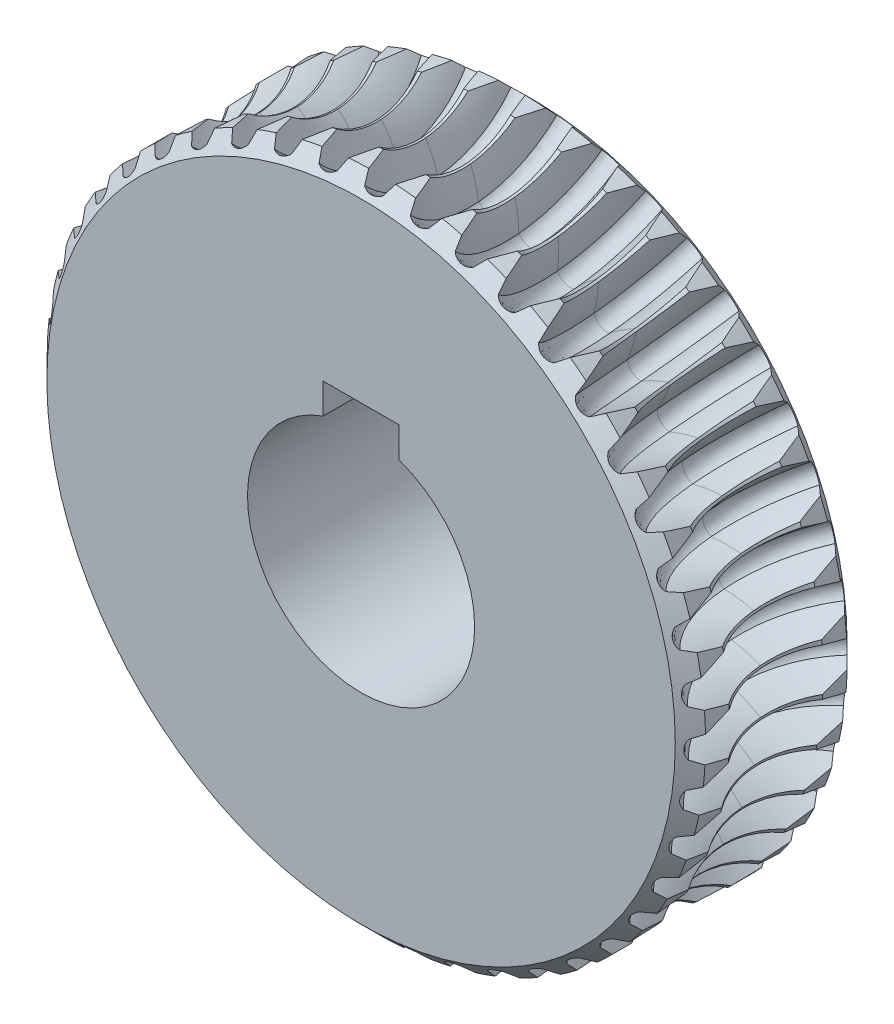
from build123d import *

# Parameters (mm, degrees)
CROQUIS1_R                 = 43.5
SALIENTE_EXTRUIR1_DEPTH    = 11.35
CHAFL_N1_SIZE              = 2
CROQUIS2_R                 = 10.5
CORTAR_BARRER1_PITCH       = 6
CORTAR_BARRER1_HEIGHT      = 1.5
CORTAR_BARRER1_RADIUS      = 10.5
CORTAR_BARRER1_START_ANGLE = -90
CORTAR_BARRER2_PITCH       = 6
CORTAR_BARRER2_HEIGHT      = 1.5
CORTAR_BARRER2_RADIUS      = 10.5
CORTAR_BARRER2_START_ANGLE = -90
MATRIZC1_COUNT             = 44


with BuildPart() as part:
    # Croquis1 → Saliente-Extruir1 (new, symmetric)
    with BuildSketch(Plane.XY):
        Circle(CROQUIS1_R)
        with BuildLine():
            Line((-5, 18.142135624), (5, 18.142135624))
            Line((5, 18.142135624), (5, 14.142135624))
            ThreePointArc((5, 14.142135624), (0, -15), (-5, 14.142135624))
            Line((-5, 14.142135624), (-5, 18.142135624))
        make_face(mode=Mode.SUBTRACT)
    extrude(amount=SALIENTE_EXTRUIR1_DEPTH, both=True)

    # Chaflán1
    chafl_n1_edges = [part.edges().sort_by_distance(p)[0] for p in [
        (-43.5, 0, -11.35),
        (-43.5, 0, 11.35),
    ]]
    chamfer(chafl_n1_edges, length=CHAFL_N1_SIZE)

    # Croquis2 → Cortar-Revolución1 (revolve, cut)
    with BuildSketch(Plane(origin=(0, 0, 0), x_dir=(0, 0, -1), z_dir=(1, 0, 0)), mode=Mode.PRIVATE) as cortar_revoluci_n1_sk:
        with Locations((0, -52)):
            Circle(CROQUIS2_R)
    revolve(cortar_revoluci_n1_sk.sketch.rotate(Axis((0, 0, 0), (0, 0, -1)), 270), axis=Axis((0, 0, 0), (0, 0, -1)), mode=Mode.SUBTRACT)

    # Cortar-Barrer1: sweep along a helix
    with BuildLine() as cortar_barrer1_path:
        add(Helix(CORTAR_BARRER1_PITCH, CORTAR_BARRER1_HEIGHT, CORTAR_BARRER1_RADIUS, center=(0, -52, 0), direction=(-1, 0, 0), lefthand=True, mode=Mode.PRIVATE).rotate(Axis((0, -52, 0), (-1, 0, 0)), CORTAR_BARRER1_START_ANGLE))
    # Croquis4 → Cortar-Barrer1 (sweep, cut)
    with BuildSketch(Plane.XY):
        with BuildLine():
            Line((-3.45, -44.94), (3.45, -44.94))
            Line((3.45, -44.94), (3.45, -42.44))
            ThreePointArc((3.45, -42.44), (2.158263743, -40.196055995), (1.201831935, -37.79))
            ThreePointArc((1.201831935, -37.79), (0, -37.33), (-1.201831935, -37.79))
            ThreePointArc((-1.201831935, -37.79), (-2.158263743, -40.196055995), (-3.45, -42.44))
            Line((-3.45, -42.44), (-3.45, -44.94))
        make_face()
    cortar_barrer1 = sweep(path=cortar_barrer1_path.line, is_frenet=True, mode=Mode.SUBTRACT)

    # Cortar-Barrer2: sweep along a helix
    with BuildLine() as cortar_barrer2_path:
        add(Helix(CORTAR_BARRER2_PITCH, CORTAR_BARRER2_HEIGHT, CORTAR_BARRER2_RADIUS, center=(0, -52, 0), direction=(1, 0, 0), lefthand=True, mode=Mode.PRIVATE).rotate(Axis((0, -52, 0), (1, 0, 0)), CORTAR_BARRER2_START_ANGLE))
    # Croquis4<2> → Cortar-Barrer2 (sweep, cut)
    with BuildSketch(Plane.XY):
        with BuildLine():
            Line((-3.45, -44.94), (3.45, -44.94))
            Line((3.45, -44.94), (3.45, -42.44))
            ThreePointArc((3.45, -42.44), (2.158263743, -40.196055995), (1.201831935, -37.79))
            ThreePointArc((1.201831935, -37.79), (0, -37.33), (-1.201831935, -37.79))
            ThreePointArc((-1.201831935, -37.79), (-2.158263743, -40.196055995), (-3.45, -42.44))
            Line((-3.45, -42.44), (-3.45, -44.94))
        make_face()
    cortar_barrer2 = sweep(path=cortar_barrer2_path.line, is_frenet=True, mode=Mode.SUBTRACT)

    # MatrizC1: Cortar-Barrer1, Cortar-Barrer2 ×44 about axis
    matrizc1_axis = Axis((0, 0, 11.35), (0, 0, -1))
    add([cortar_barrer1.rotate(matrizc1_axis, i * 360 / MATRIZC1_COUNT) for i in range(1, MATRIZC1_COUNT)], mode=Mode.SUBTRACT)
    add([cortar_barrer2.rotate(matrizc1_axis, i * 360 / MATRIZC1_COUNT) for i in range(1, MATRIZC1_COUNT)], mode=Mode.SUBTRACT)


solid = part.part
